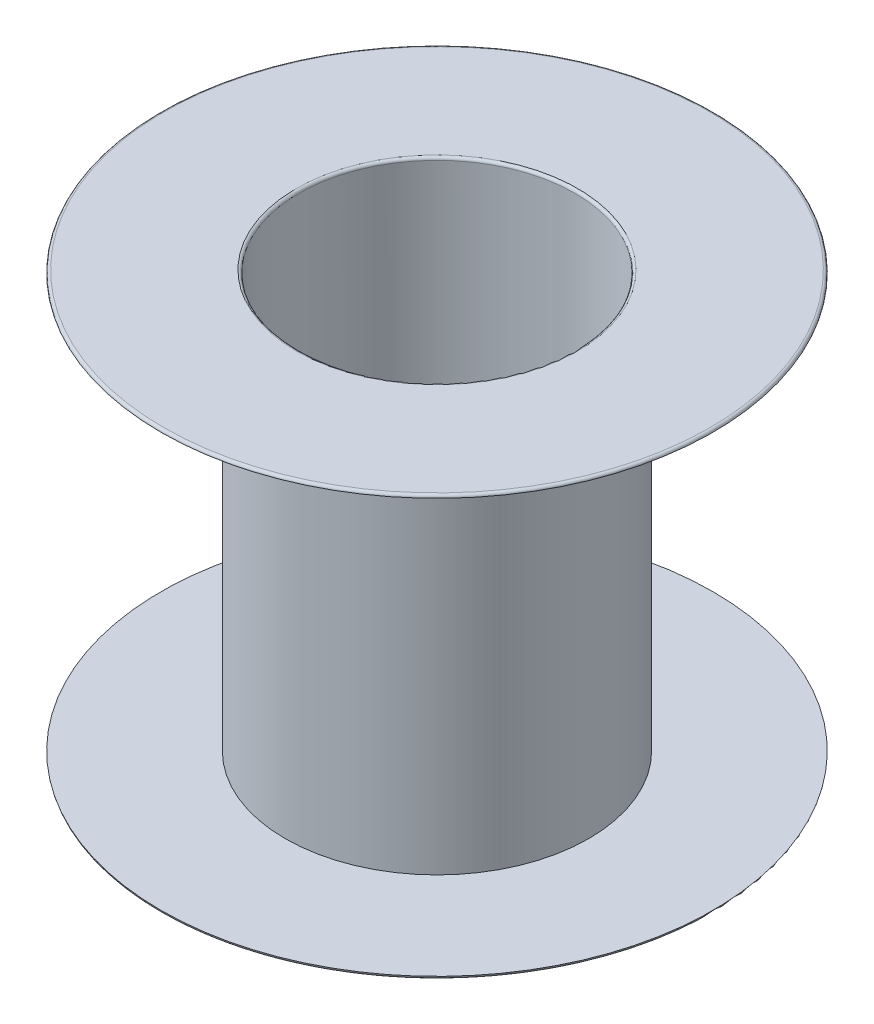
from build123d import *

# Parameters (mm, degrees)
SKETCH1_R            = 0.55
SKETCH1_R_2          = 0.5
BOSS_EXTRUDE1_DEPTH  = 1.5
SKETCH2_R            = 1
SKETCH2_R_2          = 0.5
BOSS_EXTRUDE2_DEPTH  = 0.01
FILLET1_R            = 0.01
FILLET1_OF_MIRROR1_R = 0.01


with BuildPart() as part:
    # Sketch1 → Boss-Extrude1 (new body)
    with BuildSketch(Plane(origin=(0, 0, 0), x_dir=(1, 0, 0), z_dir=(0, 1, 0))):
        with Locations(Location((0, 0, 0), (0, 0, 270))):
            Circle(SKETCH1_R)
        with Locations(Location((0, 0, 0), (0, 0, 270))):
            Circle(SKETCH1_R_2, mode=Mode.SUBTRACT)
    extrude(amount=BOSS_EXTRUDE1_DEPTH)

    # Sketch2 → Boss-Extrude2 (add)
    with BuildSketch(Plane(origin=(0, 1.5, 0), x_dir=(1, 0, 0), z_dir=(0, 1, 0))):
        with Locations(Location((0, 0, 0), (0, 0, 90))):
            Circle(SKETCH2_R)
        with Locations(Location((0, 0, 0), (0, 0, 270))):
            Circle(SKETCH2_R_2, mode=Mode.SUBTRACT)
    boss_extrude2 = extrude(amount=BOSS_EXTRUDE2_DEPTH)

    # Fillet1
    fillet1_edges = [part.edges().sort_by_distance(p)[0] for p in [
        (0, 1.51, 1),
        (0, 1.51, -0.5),
    ]]
    fillet(fillet1_edges, radius=FILLET1_R - 0.0001)  # a hair under: the kernel refuses the full size

    # Mirror1: Boss-Extrude2 across plane
    add(boss_extrude2.mirror(Plane.ZX.offset(0.75)))

    # Fillet1 of Mirror1
    fillet1_of_mirror1_edges = [part.edges().sort_by_distance(p)[0] for p in [
        (0, -0.01, 1),
        (0, -0.01, -0.5),
    ]]
    fillet(fillet1_of_mirror1_edges, radius=FILLET1_OF_MIRROR1_R - 0.0001)  # a hair under: the kernel refuses the full size


solid = part.part
